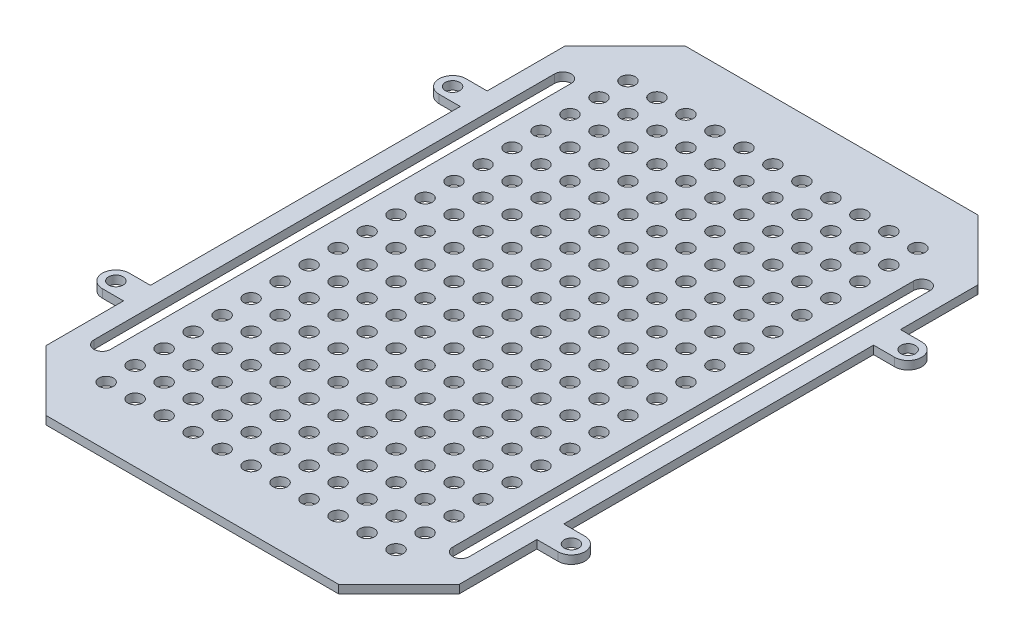
from build123d import *

# Parameters (mm, degrees)
BOSS_EXTRUDE1_DEPTH     = 2
SKETCH3_R               = 1.75
BOSS_EXTRUDE3_DEPTH     = 2
MIRROR1_START           = -2
MIRROR1_OUTLINE_R       = 1.75
MIRROR1_DEPTH           = 2
FILL_START              = -2
FILL_PATTERN2_OUTLINE_R = 1.75
FILL_PATTERN2_DEPTH     = 2
CUT_EXTRUDE1_DEPTH      = 97.739064498
FILLET2_R               = 0.5


# Read off the part's stored shape, not the designer's step: Mirror1, Fill Pattern2
with BuildPart() as part:
    # Sketch1 → Boss-Extrude1 (new body)
    with BuildSketch(Plane(origin=(0, 0, 0), x_dir=(1, 0, 0), z_dir=(0, 1, 0))):
        Polygon((0, 77.21), (35.310346366, 77.21), (49.9, 62.620346366), (49.9, 0), (0, 0), align=None)
    extrude(amount=-BOSS_EXTRUDE1_DEPTH)

    # Sketch3 → Boss-Extrude3 (add)
    with BuildSketch(Plane(origin=(0, 0, 0), x_dir=(-1, 0, 0), z_dir=(0, -1, 0))):
        with BuildLine():
            Line((-49.9, 43.901951673), (-55, 43.901951673))
            ThreePointArc((-55, 43.901951673), (-58.25, 40.651951673), (-55, 37.401951673))
            Line((-55, 37.401951673), (-49.9, 37.401951673))
            Line((-49.9, 37.401951673), (-49.9, 43.901951673))
        make_face()
        with Locations(Location((-55, 40.651951673, 0), (0, 0, 270))):
            Circle(SKETCH3_R, mode=Mode.SUBTRACT)
    extrude(amount=BOSS_EXTRUDE3_DEPTH)

    # Mirror1 outline → Mirror1 (add)
    with BuildSketch(Plane(origin=(0, 0, 0), x_dir=(1, 0, 0), z_dir=(0, 1, 0)).offset(MIRROR1_START)):
        with BuildLine():
            Line((49.9, -37.401951673), (49.9, 0))
            Line((49.9, 0), (0, 0))
            Line((0, 0), (0, 77.21))
            Line((0, 77.21), (-35.310346366, 77.21))
            Line((-35.310346366, 77.21), (-49.9, 62.620346366))
            Line((-49.9, 62.620346366), (-49.9, 43.901951673))
            Line((-49.9, 43.901951673), (-55, 43.901951673))
            ThreePointArc((-55, 43.901951673), (-58.25, 40.651951673), (-55, 37.401951673))
            Line((-55, 37.401951673), (-49.9, 37.401951673))
            Line((-49.9, 37.401951673), (-49.9, -37.401951673))
            Line((-49.9, -37.401951673), (-55, -37.401951673))
            ThreePointArc((-55, -37.401951673), (-58.25, -40.651951673), (-55, -43.901951673))
            Line((-55, -43.901951673), (-49.9, -43.901951673))
            Line((-49.9, -43.901951673), (-49.9, -62.620346366))
            Line((-49.9, -62.620346366), (-35.310346366, -77.21))
            Line((-35.310346366, -77.21), (35.310346366, -77.21))
            Line((35.310346366, -77.21), (49.9, -62.620346366))
            Line((49.9, -62.620346366), (49.9, -43.901951673))
            Line((49.9, -43.901951673), (55, -43.901951673))
            ThreePointArc((55, -43.901951673), (58.25, -40.651951673), (55, -37.401951673))
            Line((55, -37.401951673), (49.9, -37.401951673))
        make_face()
        with Locations((-55, -40.651951673)):
            Circle(MIRROR1_OUTLINE_R, mode=Mode.SUBTRACT)
        with Locations((55, -40.651951673)):
            Circle(MIRROR1_OUTLINE_R, mode=Mode.SUBTRACT)
        with Locations((-55, 40.651951673)):
            Circle(MIRROR1_OUTLINE_R, mode=Mode.SUBTRACT)
    extrude(amount=MIRROR1_DEPTH)

    # Fill Pattern2 outline → Fill Pattern2 (cut)
    with BuildSketch(Plane(origin=(0, 0, 0), x_dir=(1, 0, 0), z_dir=(0, 1, 0)).offset(FILL_START)):
        Circle(FILL_PATTERN2_OUTLINE_R)
        with Locations((-35, -7)):
            Circle(FILL_PATTERN2_OUTLINE_R)
        with Locations((14, -49)):
            Circle(FILL_PATTERN2_OUTLINE_R)
        with Locations((-21, -42)):
            Circle(FILL_PATTERN2_OUTLINE_R)
        with Locations((-35, -14)):
            Circle(FILL_PATTERN2_OUTLINE_R)
        with Locations((-28, -42)):
            Circle(FILL_PATTERN2_OUTLINE_R)
        with Locations((7, -49)):
            Circle(FILL_PATTERN2_OUTLINE_R)
        with Locations((-35, 0)):
            Circle(FILL_PATTERN2_OUTLINE_R)
        with Locations((-35, -42)):
            Circle(FILL_PATTERN2_OUTLINE_R)
        with Locations((-7, -42)):
            Circle(FILL_PATTERN2_OUTLINE_R)
        with Locations((-35, -28)):
            Circle(FILL_PATTERN2_OUTLINE_R)
        with Locations((-28, 21)):
            Circle(FILL_PATTERN2_OUTLINE_R)
        with Locations((35, -49)):
            Circle(FILL_PATTERN2_OUTLINE_R)
        with Locations((21, -49)):
            Circle(FILL_PATTERN2_OUTLINE_R)
        with Locations((-14, -42)):
            Circle(FILL_PATTERN2_OUTLINE_R)
        with Locations((-35, -21)):
            Circle(FILL_PATTERN2_OUTLINE_R)
        with Locations((28, -49)):
            Circle(FILL_PATTERN2_OUTLINE_R)
        with Locations((-35, 28)):
            Circle(FILL_PATTERN2_OUTLINE_R)
        with Locations((14, -56)):
            Circle(FILL_PATTERN2_OUTLINE_R)
        with Locations((-21, -49)):
            Circle(FILL_PATTERN2_OUTLINE_R)
        with Locations((-35, 21)):
            Circle(FILL_PATTERN2_OUTLINE_R)
        with Locations((0, -56)):
            Circle(FILL_PATTERN2_OUTLINE_R)
        with Locations((-35, -49)):
            Circle(FILL_PATTERN2_OUTLINE_R)
        with Locations((7, -56)):
            Circle(FILL_PATTERN2_OUTLINE_R)
        with Locations((-28, -49)):
            Circle(FILL_PATTERN2_OUTLINE_R)
        with Locations((0, -49)):
            Circle(FILL_PATTERN2_OUTLINE_R)
        with Locations((35, -56)):
            Circle(FILL_PATTERN2_OUTLINE_R)
        with Locations((-35, 7)):
            Circle(FILL_PATTERN2_OUTLINE_R)
        with Locations((-7, -49)):
            Circle(FILL_PATTERN2_OUTLINE_R)
        with Locations((21, -56)):
            Circle(FILL_PATTERN2_OUTLINE_R)
        with Locations((-14, -49)):
            Circle(FILL_PATTERN2_OUTLINE_R)
        with Locations((-35, 14)):
            Circle(FILL_PATTERN2_OUTLINE_R)
        with Locations((28, -56)):
            Circle(FILL_PATTERN2_OUTLINE_R)
        with Locations((14, -35)):
            Circle(FILL_PATTERN2_OUTLINE_R)
        with Locations((-21, -28)):
            Circle(FILL_PATTERN2_OUTLINE_R)
        with Locations((-21, 14)):
            Circle(FILL_PATTERN2_OUTLINE_R)
        with Locations((21, -35)):
            Circle(FILL_PATTERN2_OUTLINE_R)
        with Locations((0, -35)):
            Circle(FILL_PATTERN2_OUTLINE_R)
        with Locations((-28, -21)):
            Circle(FILL_PATTERN2_OUTLINE_R)
        with Locations((7, -35)):
            Circle(FILL_PATTERN2_OUTLINE_R)
        with Locations((-28, -28)):
            Circle(FILL_PATTERN2_OUTLINE_R)
        with Locations((-21, 0)):
            Circle(FILL_PATTERN2_OUTLINE_R)
        with Locations((35, -35)):
            Circle(FILL_PATTERN2_OUTLINE_R)
        with Locations((0, -28)):
            Circle(FILL_PATTERN2_OUTLINE_R)
        with Locations((-21, -7)):
            Circle(FILL_PATTERN2_OUTLINE_R)
        with Locations((-7, -28)):
            Circle(FILL_PATTERN2_OUTLINE_R)
        with Locations((28, -35)):
            Circle(FILL_PATTERN2_OUTLINE_R)
        with Locations((-21, 7)):
            Circle(FILL_PATTERN2_OUTLINE_R)
        with Locations((-14, -28)):
            Circle(FILL_PATTERN2_OUTLINE_R)
        with Locations((-21, -35)):
            Circle(FILL_PATTERN2_OUTLINE_R)
        with Locations((14, -42)):
            Circle(FILL_PATTERN2_OUTLINE_R)
        with Locations((-28, 7)):
            Circle(FILL_PATTERN2_OUTLINE_R)
        with Locations((-28, -35)):
            Circle(FILL_PATTERN2_OUTLINE_R)
        with Locations((0, -42)):
            Circle(FILL_PATTERN2_OUTLINE_R)
        with Locations((-35, -35)):
            Circle(FILL_PATTERN2_OUTLINE_R)
        with Locations((-28, 14)):
            Circle(FILL_PATTERN2_OUTLINE_R)
        with Locations((7, -42)):
            Circle(FILL_PATTERN2_OUTLINE_R)
        with Locations((28, -42)):
            Circle(FILL_PATTERN2_OUTLINE_R)
        with Locations((-7, -35)):
            Circle(FILL_PATTERN2_OUTLINE_R)
        with Locations((-28, -14)):
            Circle(FILL_PATTERN2_OUTLINE_R)
        with Locations((35, -42)):
            Circle(FILL_PATTERN2_OUTLINE_R)
        with Locations((-28, 0)):
            Circle(FILL_PATTERN2_OUTLINE_R)
        with Locations((21, -42)):
            Circle(FILL_PATTERN2_OUTLINE_R)
        with Locations((-14, -35)):
            Circle(FILL_PATTERN2_OUTLINE_R)
        with Locations((-28, -7)):
            Circle(FILL_PATTERN2_OUTLINE_R)
        with Locations((-7, -63)):
            Circle(FILL_PATTERN2_OUTLINE_R)
        with Locations((0, -63)):
            Circle(FILL_PATTERN2_OUTLINE_R)
        with Locations((-35, -56)):
            Circle(FILL_PATTERN2_OUTLINE_R)
        with Locations((7, -63)):
            Circle(FILL_PATTERN2_OUTLINE_R)
        with Locations((-14, -63)):
            Circle(FILL_PATTERN2_OUTLINE_R)
        with Locations((-21, -63)):
            Circle(FILL_PATTERN2_OUTLINE_R)
        with Locations((-28, -63)):
            Circle(FILL_PATTERN2_OUTLINE_R)
        with Locations((-35, -63)):
            Circle(FILL_PATTERN2_OUTLINE_R)
        with Locations((-14, -56)):
            Circle(FILL_PATTERN2_OUTLINE_R)
        with Locations((28, -63)):
            Circle(FILL_PATTERN2_OUTLINE_R)
        with Locations((-7, -56)):
            Circle(FILL_PATTERN2_OUTLINE_R)
        with Locations((35, -63)):
            Circle(FILL_PATTERN2_OUTLINE_R)
        with Locations((-28, -56)):
            Circle(FILL_PATTERN2_OUTLINE_R)
        with Locations((14, -63)):
            Circle(FILL_PATTERN2_OUTLINE_R)
        with Locations((-21, -56)):
            Circle(FILL_PATTERN2_OUTLINE_R)
        with Locations((21, -63)):
            Circle(FILL_PATTERN2_OUTLINE_R)
        with Locations((14, 28)):
            Circle(FILL_PATTERN2_OUTLINE_R)
        with Locations((21, 21)):
            Circle(FILL_PATTERN2_OUTLINE_R)
        with Locations((14, 0)):
            Circle(FILL_PATTERN2_OUTLINE_R)
        with Locations((-7, -7)):
            Circle(FILL_PATTERN2_OUTLINE_R)
        with Locations((-28, 63)):
            Circle(FILL_PATTERN2_OUTLINE_R)
        with Locations((-21, 56)):
            Circle(FILL_PATTERN2_OUTLINE_R)
        with Locations((-14, 49)):
            Circle(FILL_PATTERN2_OUTLINE_R)
        with Locations((-7, 42)):
            Circle(FILL_PATTERN2_OUTLINE_R)
        with Locations((0, -7)):
            Circle(FILL_PATTERN2_OUTLINE_R)
        with Locations((-35, 63)):
            Circle(FILL_PATTERN2_OUTLINE_R)
        with Locations((-28, 56)):
            Circle(FILL_PATTERN2_OUTLINE_R)
        with Locations((-21, 49)):
            Circle(FILL_PATTERN2_OUTLINE_R)
        with Locations((14, 7)):
            Circle(FILL_PATTERN2_OUTLINE_R)
        with Locations((14, 21)):
            Circle(FILL_PATTERN2_OUTLINE_R)
        with Locations((7, 28)):
            Circle(FILL_PATTERN2_OUTLINE_R)
        with Locations((0, 35)):
            Circle(FILL_PATTERN2_OUTLINE_R)
        with Locations((21, 28)):
            Circle(FILL_PATTERN2_OUTLINE_R)
        with Locations((14, 35)):
            Circle(FILL_PATTERN2_OUTLINE_R)
        with Locations((7, 42)):
            Circle(FILL_PATTERN2_OUTLINE_R)
        with Locations((0, 49)):
            Circle(FILL_PATTERN2_OUTLINE_R)
        with Locations((-7, 56)):
            Circle(FILL_PATTERN2_OUTLINE_R)
        with Locations((-14, 63)):
            Circle(FILL_PATTERN2_OUTLINE_R)
        with Locations((14, -14)):
            Circle(FILL_PATTERN2_OUTLINE_R)
        with Locations((21, 7)):
            Circle(FILL_PATTERN2_OUTLINE_R)
        with Locations((7, 35)):
            Circle(FILL_PATTERN2_OUTLINE_R)
        with Locations((0, 42)):
            Circle(FILL_PATTERN2_OUTLINE_R)
        with Locations((-7, 49)):
            Circle(FILL_PATTERN2_OUTLINE_R)
        with Locations((-14, 56)):
            Circle(FILL_PATTERN2_OUTLINE_R)
        with Locations((-21, 63)):
            Circle(FILL_PATTERN2_OUTLINE_R)
        with Locations((-7, 0)):
            Circle(FILL_PATTERN2_OUTLINE_R)
        with Locations((14, -7)):
            Circle(FILL_PATTERN2_OUTLINE_R)
        with Locations((21, 14)):
            Circle(FILL_PATTERN2_OUTLINE_R)
        with Locations((7, 7)):
            Circle(FILL_PATTERN2_OUTLINE_R)
        with Locations((-35, 42)):
            Circle(FILL_PATTERN2_OUTLINE_R)
        with Locations((-28, 35)):
            Circle(FILL_PATTERN2_OUTLINE_R)
        with Locations((-21, 28)):
            Circle(FILL_PATTERN2_OUTLINE_R)
        with Locations((0, 14)):
            Circle(FILL_PATTERN2_OUTLINE_R)
        with Locations((-7, 21)):
            Circle(FILL_PATTERN2_OUTLINE_R)
        with Locations((-14, 28)):
            Circle(FILL_PATTERN2_OUTLINE_R)
        with Locations((-21, 35)):
            Circle(FILL_PATTERN2_OUTLINE_R)
        with Locations((-7, 7)):
            Circle(FILL_PATTERN2_OUTLINE_R)
        with Locations((-14, 14)):
            Circle(FILL_PATTERN2_OUTLINE_R)
        with Locations((-21, 21)):
            Circle(FILL_PATTERN2_OUTLINE_R)
        with Locations((-28, 28)):
            Circle(FILL_PATTERN2_OUTLINE_R)
        with Locations((-14, 21)):
            Circle(FILL_PATTERN2_OUTLINE_R)
        with Locations((-7, 14)):
            Circle(FILL_PATTERN2_OUTLINE_R)
        with Locations((0, 7)):
            Circle(FILL_PATTERN2_OUTLINE_R)
        with Locations((-35, 35)):
            Circle(FILL_PATTERN2_OUTLINE_R)
        with Locations((-28, 49)):
            Circle(FILL_PATTERN2_OUTLINE_R)
        with Locations((-35, 56)):
            Circle(FILL_PATTERN2_OUTLINE_R)
        with Locations((7, -7)):
            Circle(FILL_PATTERN2_OUTLINE_R)
        with Locations((14, 14)):
            Circle(FILL_PATTERN2_OUTLINE_R)
        with Locations((7, 21)):
            Circle(FILL_PATTERN2_OUTLINE_R)
        with Locations((0, 28)):
            Circle(FILL_PATTERN2_OUTLINE_R)
        with Locations((-7, 35)):
            Circle(FILL_PATTERN2_OUTLINE_R)
        with Locations((-14, 42)):
            Circle(FILL_PATTERN2_OUTLINE_R)
        with Locations((-28, 42)):
            Circle(FILL_PATTERN2_OUTLINE_R)
        with Locations((-35, 49)):
            Circle(FILL_PATTERN2_OUTLINE_R)
        with Locations((7, 0)):
            Circle(FILL_PATTERN2_OUTLINE_R)
        with Locations((7, 14)):
            Circle(FILL_PATTERN2_OUTLINE_R)
        with Locations((0, 21)):
            Circle(FILL_PATTERN2_OUTLINE_R)
        with Locations((-7, 28)):
            Circle(FILL_PATTERN2_OUTLINE_R)
        with Locations((-14, 35)):
            Circle(FILL_PATTERN2_OUTLINE_R)
        with Locations((-21, 42)):
            Circle(FILL_PATTERN2_OUTLINE_R)
        with Locations((35, 14)):
            Circle(FILL_PATTERN2_OUTLINE_R)
        with Locations((35, 56)):
            Circle(FILL_PATTERN2_OUTLINE_R)
        with Locations((28, 63)):
            Circle(FILL_PATTERN2_OUTLINE_R)
        with Locations((-14, 0)):
            Circle(FILL_PATTERN2_OUTLINE_R)
        with Locations((7, -21)):
            Circle(FILL_PATTERN2_OUTLINE_R)
        with Locations((28, -14)):
            Circle(FILL_PATTERN2_OUTLINE_R)
        with Locations((35, 7)):
            Circle(FILL_PATTERN2_OUTLINE_R)
        with Locations((35, 63)):
            Circle(FILL_PATTERN2_OUTLINE_R)
        with Locations((28, 0)):
            Circle(FILL_PATTERN2_OUTLINE_R)
        with Locations((35, 21)):
            Circle(FILL_PATTERN2_OUTLINE_R)
        with Locations((35, 49)):
            Circle(FILL_PATTERN2_OUTLINE_R)
        with Locations((28, 56)):
            Circle(FILL_PATTERN2_OUTLINE_R)
        with Locations((28, -7)):
            Circle(FILL_PATTERN2_OUTLINE_R)
        with Locations((14, -21)):
            Circle(FILL_PATTERN2_OUTLINE_R)
        with Locations((-14, -7)):
            Circle(FILL_PATTERN2_OUTLINE_R)
        with Locations((21, 63)):
            Circle(FILL_PATTERN2_OUTLINE_R)
        with Locations((21, -28)):
            Circle(FILL_PATTERN2_OUTLINE_R)
        with Locations((35, -14)):
            Circle(FILL_PATTERN2_OUTLINE_R)
        with Locations((-21, -21)):
            Circle(FILL_PATTERN2_OUTLINE_R)
        with Locations((14, -28)):
            Circle(FILL_PATTERN2_OUTLINE_R)
        with Locations((35, -21)):
            Circle(FILL_PATTERN2_OUTLINE_R)
        with Locations((-21, -14)):
            Circle(FILL_PATTERN2_OUTLINE_R)
        with Locations((7, -28)):
            Circle(FILL_PATTERN2_OUTLINE_R)
        with Locations((35, -28)):
            Circle(FILL_PATTERN2_OUTLINE_R)
        with Locations((-14, 7)):
            Circle(FILL_PATTERN2_OUTLINE_R)
        with Locations((0, -21)):
            Circle(FILL_PATTERN2_OUTLINE_R)
        with Locations((28, -21)):
            Circle(FILL_PATTERN2_OUTLINE_R)
        with Locations((35, 0)):
            Circle(FILL_PATTERN2_OUTLINE_R)
        with Locations((-14, -21)):
            Circle(FILL_PATTERN2_OUTLINE_R)
        with Locations((35, -7)):
            Circle(FILL_PATTERN2_OUTLINE_R)
        with Locations((28, -28)):
            Circle(FILL_PATTERN2_OUTLINE_R)
        with Locations((-7, -21)):
            Circle(FILL_PATTERN2_OUTLINE_R)
        with Locations((28, 21)):
            Circle(FILL_PATTERN2_OUTLINE_R)
        with Locations((28, 35)):
            Circle(FILL_PATTERN2_OUTLINE_R)
        with Locations((21, 42)):
            Circle(FILL_PATTERN2_OUTLINE_R)
        with Locations((14, 49)):
            Circle(FILL_PATTERN2_OUTLINE_R)
        with Locations((7, 56)):
            Circle(FILL_PATTERN2_OUTLINE_R)
        with Locations((0, 63)):
            Circle(FILL_PATTERN2_OUTLINE_R)
        with Locations((0, -14)):
            Circle(FILL_PATTERN2_OUTLINE_R)
        with Locations((21, -7)):
            Circle(FILL_PATTERN2_OUTLINE_R)
        with Locations((28, 28)):
            Circle(FILL_PATTERN2_OUTLINE_R)
        with Locations((21, 35)):
            Circle(FILL_PATTERN2_OUTLINE_R)
        with Locations((14, 42)):
            Circle(FILL_PATTERN2_OUTLINE_R)
        with Locations((7, 49)):
            Circle(FILL_PATTERN2_OUTLINE_R)
        with Locations((0, 56)):
            Circle(FILL_PATTERN2_OUTLINE_R)
        with Locations((-7, 63)):
            Circle(FILL_PATTERN2_OUTLINE_R)
        with Locations((7, -14)):
            Circle(FILL_PATTERN2_OUTLINE_R)
        with Locations((21, 0)):
            Circle(FILL_PATTERN2_OUTLINE_R)
        with Locations((21, -21)):
            Circle(FILL_PATTERN2_OUTLINE_R)
        with Locations((-14, -14)):
            Circle(FILL_PATTERN2_OUTLINE_R)
        with Locations((14, 63)):
            Circle(FILL_PATTERN2_OUTLINE_R)
        with Locations((21, 56)):
            Circle(FILL_PATTERN2_OUTLINE_R)
        with Locations((28, 49)):
            Circle(FILL_PATTERN2_OUTLINE_R)
        with Locations((35, 42)):
            Circle(FILL_PATTERN2_OUTLINE_R)
        with Locations((35, 28)):
            Circle(FILL_PATTERN2_OUTLINE_R)
        with Locations((28, 7)):
            Circle(FILL_PATTERN2_OUTLINE_R)
        with Locations((28, 14)):
            Circle(FILL_PATTERN2_OUTLINE_R)
        with Locations((35, 35)):
            Circle(FILL_PATTERN2_OUTLINE_R)
        with Locations((28, 42)):
            Circle(FILL_PATTERN2_OUTLINE_R)
        with Locations((21, 49)):
            Circle(FILL_PATTERN2_OUTLINE_R)
        with Locations((14, 56)):
            Circle(FILL_PATTERN2_OUTLINE_R)
        with Locations((7, 63)):
            Circle(FILL_PATTERN2_OUTLINE_R)
        with Locations((-7, -14)):
            Circle(FILL_PATTERN2_OUTLINE_R)
        with Locations((21, -14)):
            Circle(FILL_PATTERN2_OUTLINE_R)
    extrude(amount=FILL_PATTERN2_DEPTH, mode=Mode.SUBTRACT)

    # Sketch5 → Cut-Extrude1 (cut, through all)
    with BuildSketch(Plane(origin=(0, 0, 0), x_dir=(1, 0, 0), z_dir=(0, 1, 0))):
        with BuildLine():
            Line((-45.325, -55.620346366), (-45.325, 55.620346366))
            ThreePointArc((-45.325, 55.620346366), (-43.325, 57.620346366), (-41.325, 55.620346366))
            Line((-41.325, 55.620346366), (-41.325, -55.620346366))
            ThreePointArc((-41.325, -55.620346366), (-43.325, -57.620346366), (-45.325, -55.620346366))
        make_face()
        with BuildLine():
            Line((41.325, -55.620346366), (41.325, 55.620346366))
            ThreePointArc((41.325, 55.620346366), (43.325, 57.620346366), (45.325, 55.620346366))
            Line((45.325, 55.620346366), (45.325, -55.620346366))
            ThreePointArc((45.325, -55.620346366), (43.325, -57.620346366), (41.325, -55.620346366))
        make_face()
    extrude(amount=-CUT_EXTRUDE1_DEPTH, mode=Mode.SUBTRACT)

    # Fillet2
    fillet2_edges = [part.edges().sort_by_distance(p)[0] for p in [
        (49.9, -1, -62.620346366),
        (35.310346366, -1, -77.21),
    ]]
    fillet(fillet2_edges, radius=FILLET2_R)


solid = part.part
